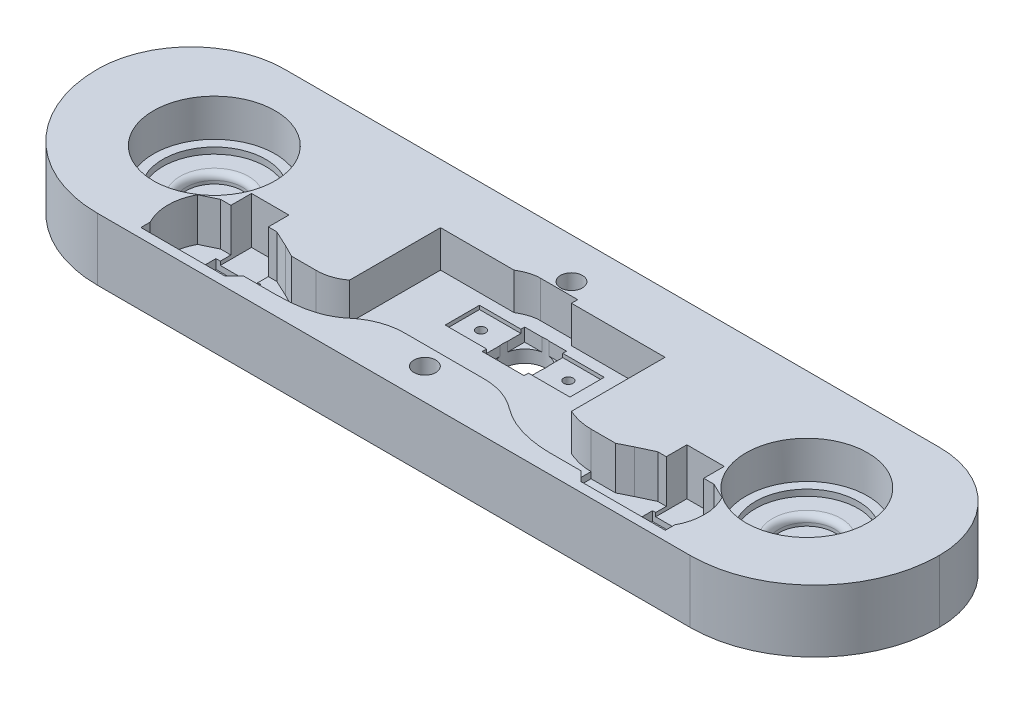
from build123d import *

# Parameters (mm, degrees)
SKETCH1_W                = 135
SKETCH1_H                = 35
BOSS_EXTRUDE1_DEPTH      = 10
FILLET1_R                = 20
CUT_EXTRUDE3_REACH       = 93.483
SKETCH5_R                = 1.75
SKETCH6_R                = 3.1
CUT_EXTRUDE4_DEPTH       = 4
FILLET2_R                = 15
SKETCH3_R                = 9.75
CUT_EXTRUDE5_DEPTH       = 7
BOSS_EXTRUDE2_START      = 1
SKETCH9_R                = 9.75
SKETCH9_R_2              = 8.25
BOSS_EXTRUDE2_DEPTH      = 1
SKETCH10_R               = 4.5
CUT_EXTRUDE6_DEPTH       = 1.5
FILLET3_R                = 1
CUT_EXTRUDE7_REACH       = 93.483
SKETCH7_R                = 2.5
SKETCH11_W               = 7.2
SKETCH11_H               = 6.2
CUT_EXTRUDE8_DEPTH       = 8.4
CUT_EXTRUDE9_DEPTH       = 6.9
CUT_EXTRUDE10_DEPTH      = 5.9
CUT_EXTRUDE11_REACH      = 93.483
SKETCH14_R               = 3.4
CUT_EXTRUDE12_DEPTH      = 5.9
CUT_EXTRUDE12_DEPTH_BACK = 2.1
SKETCH15_W               = 6.7
SKETCH15_H               = 6.8
SKETCH16_W               = 36
SKETCH16_H               = 17.5
CUT_EXTRUDE13_DEPTH      = 5.9
SKETCH18_W               = 6
SKETCH18_H               = 5
CUT_EXTRUDE14_DEPTH      = 7.5
SKETCH19_W               = 13
SKETCH19_H               = 1.5
CUT_EXTRUDE15_DEPTH      = 6.9
CHAMFER1_SIZE            = 2
CUT_EXTRUDE16_REACH      = 93.196
SKETCH20_R               = 0.7
SKETCH22_W               = 20
SKETCH22_H               = 5.5
CUT_EXTRUDE18_DEPTH      = 0.6
CUT_EXTRUDE19_REACH      = 93.166
SKETCH23_R               = 0.75
FILLET4_R                = 10


# Some blends are built 0.0001 mm under size
with BuildPart() as part:
    # Sketch1 → Boss-Extrude1 (new body)
    with BuildSketch(Plane(origin=(0, 0, 0), x_dir=(1, 0, 0), z_dir=(0, 1, 0))):
        with Locations((19.749798241, -8.123070146)):
            Rectangle(SKETCH1_W, SKETCH1_H)
    extrude(amount=BOSS_EXTRUDE1_DEPTH)

    # Fillet1
    fillet1_edges = [part.edges().sort_by_distance(p)[0] for p in [
        (87.249798241, 5, 25.623070146),
        (-47.750201759, 5, 25.623070146),
    ]]
    fillet(fillet1_edges, radius=FILLET1_R)

    # Sketch5 → Cut-Extrude3 (cut, up to next)
    with BuildSketch(Plane(origin=(0, 10, 0), x_dir=(1, 0, 0), z_dir=(0, 1, 0)), mode=Mode.PRIVATE) as cut_extrude3_sk1:
        with Locations(Location((19.749798241, 2.876929854, 0), (0, 0, 270))):
            Circle(SKETCH5_R)
    cut_extrude3_tool1 = extrude(cut_extrude3_sk1.sketch, amount=-CUT_EXTRUDE3_REACH, mode=Mode.PRIVATE) & part.part
    # Sketch5 → Cut-Extrude3 (cut, up to next)
    with BuildSketch(Plane(origin=(0, 10, 0), x_dir=(1, 0, 0), z_dir=(0, 1, 0)), mode=Mode.PRIVATE) as cut_extrude3_sk2:
        with Locations(Location((19.749798241, -20.623070146, 0), (0, 0, 270))):
            Circle(SKETCH5_R)
    cut_extrude3_tool2 = extrude(cut_extrude3_sk2.sketch, amount=-CUT_EXTRUDE3_REACH, mode=Mode.PRIVATE) & part.part
    add(cut_extrude3_tool1.solids().sort_by_distance((19.749798, 10, -2.87693))[0], mode=Mode.SUBTRACT)
    add(cut_extrude3_tool2.solids().sort_by_distance((19.749798, 10, 20.62307))[0], mode=Mode.SUBTRACT)

    # Sketch6 → Cut-Extrude4 (cut)
    with BuildSketch(Plane.XZ):
        with Locations(Location((19.749798241, 20.623070146, 0), (0, 0, 270))):
            Circle(SKETCH6_R)
        with Locations(Location((19.749798241, -2.876929854, 0), (0, 0, 270))):
            Circle(SKETCH6_R)
    extrude(amount=-CUT_EXTRUDE4_DEPTH, mode=Mode.SUBTRACT)

    # Fillet2
    fillet2_edges = [part.edges().sort_by_distance(p)[0] for p in [
        (-47.750201759, 5, -9.376929854),
        (87.249798241, 5, -9.376929854),
    ]]
    fillet(fillet2_edges, radius=FILLET2_R - 0.0001)  # a hair under: the kernel refuses the full size

    # Sketch3 → Cut-Extrude5 (cut)
    with BuildSketch(Plane(origin=(0, 10, 0), x_dir=(1, 0, 0), z_dir=(0, 1, 0))):
        with Locations(Location((-27.750201759, -6.88629089, 0), (0, 0, 270))):
            Circle(SKETCH3_R)
        with Locations(Location((67.249798241, -6.88629089, 0), (0, 0, 90))):
            Circle(SKETCH3_R)
    extrude(amount=-CUT_EXTRUDE5_DEPTH, mode=Mode.SUBTRACT)

    # Sketch9 → Boss-Extrude2 (add)
    # profile 1 of 2: a face of its own
    with BuildSketch(Plane(origin=(0, 3, 0), x_dir=(1, 0, 0), z_dir=(0, 1, 0)).offset(BOSS_EXTRUDE2_START)):
        with Locations(Location((-27.750201759, -6.88629089, 0), (0, 0, 270))):
            Circle(SKETCH9_R)
        with Locations(Location((-27.750201759, -6.88629089, 0), (0, 0, 270))):
            Circle(SKETCH9_R_2, mode=Mode.SUBTRACT)
    # profile 2 of 2: a face of its own
    with BuildSketch(Plane(origin=(0, 3, 0), x_dir=(1, 0, 0), z_dir=(0, 1, 0)).offset(BOSS_EXTRUDE2_START)):
        with Locations(Location((67.249798241, -6.88629089, 0), (0, 0, 270))):
            Circle(SKETCH9_R)
        with Locations(Location((67.249798241, -6.88629089, 0), (0, 0, 270))):
            Circle(SKETCH9_R_2, mode=Mode.SUBTRACT)
    extrude(amount=-BOSS_EXTRUDE2_DEPTH)

    # Sketch10 → Cut-Extrude6 (cut)
    with BuildSketch(Plane(origin=(0, 3, 0), x_dir=(1, 0, 0), z_dir=(0, 1, 0))):
        with Locations(Location((-27.750201759, -6.88629089, 0), (0, 0, 270))):
            Circle(SKETCH10_R)
        with Locations(Location((67.249798241, -6.88629089, 0), (0, 0, 270))):
            Circle(SKETCH10_R)
    extrude(amount=-CUT_EXTRUDE6_DEPTH, mode=Mode.SUBTRACT)

    # Fillet3
    fillet3_edges = [part.edges().sort_by_distance(p)[0] for p in [
        (-27.750201759, 3, 2.38629089),
        (67.249798241, 3, 2.38629089),
    ]]
    fillet(fillet3_edges, radius=FILLET3_R)

    # Sketch7 → Cut-Extrude7 (cut, up to next)
    with BuildSketch(Plane(origin=(0, 10, 0), x_dir=(1, 0, 0), z_dir=(0, 1, 0)), mode=Mode.PRIVATE) as cut_extrude7_sk1:
        with Locations(Location((-15.250201759, -18.623070146, 0), (0, 0, 270))):
            Circle(SKETCH7_R)
    cut_extrude7_tool1 = extrude(cut_extrude7_sk1.sketch, amount=-CUT_EXTRUDE7_REACH, mode=Mode.PRIVATE) & part.part
    # Sketch7 → Cut-Extrude7 (cut, up to next)
    with BuildSketch(Plane(origin=(0, 10, 0), x_dir=(1, 0, 0), z_dir=(0, 1, 0)), mode=Mode.PRIVATE) as cut_extrude7_sk2:
        with Locations(Location((54.749798241, -18.623070146, 0), (0, 0, 270))):
            Circle(SKETCH7_R)
    cut_extrude7_tool2 = extrude(cut_extrude7_sk2.sketch, amount=-CUT_EXTRUDE7_REACH, mode=Mode.PRIVATE) & part.part
    add(cut_extrude7_tool1.solids().sort_by_distance((-15.250202, 10, 18.62307))[0], mode=Mode.SUBTRACT)
    add(cut_extrude7_tool2.solids().sort_by_distance((54.749798, 10, 18.62307))[0], mode=Mode.SUBTRACT)

    # Sketch11 → Cut-Extrude8 (cut)
    with BuildSketch(Plane(origin=(0, 10, 0), x_dir=(1, 0, 0), z_dir=(0, 1, 0))):
        with Locations((-15.250201759, -18.623070146)):
            Rectangle(SKETCH11_W, SKETCH11_H)
        with Locations((54.749798241, -18.623070146)):
            Rectangle(SKETCH11_W, SKETCH11_H)
    extrude(amount=-CUT_EXTRUDE8_DEPTH, mode=Mode.SUBTRACT)

    # Sketch12 → Cut-Extrude9 (cut)
    with BuildSketch(Plane(origin=(0, 10, 0), x_dir=(1, 0, 0), z_dir=(0, 1, 0))):
        with BuildLine():
            Line((-2.290088122, -16.023070146), (-2.290088122, -22.623070146))
            Line((-2.290088122, -22.623070146), (-22.290088122, -22.623070146))
            ThreePointArc((-22.290088122, -22.623070146), (-23.250201759, -18.823070146), (-22.290088122, -15.023070146))
            Line((-22.290088122, -15.023070146), (-8.226250735, -15.023070146))
            Line((-8.226250735, -15.023070146), (-6.226250735, -16.023070146))
            Line((-6.226250735, -16.023070146), (-2.290088122, -16.023070146))
        make_face()
        with BuildLine():
            Line((45.725847218, -16.023070146), (41.789684604, -16.023070146))
            Line((41.789684604, -16.023070146), (41.789684604, -22.623070146))
            Line((41.789684604, -22.623070146), (61.789684604, -22.623070146))
            ThreePointArc((61.789684604, -22.623070146), (62.749798241, -18.823070146), (61.789684604, -15.023070146))
            Line((61.789684604, -15.023070146), (47.725847218, -15.023070146))
            Line((47.725847218, -15.023070146), (45.725847218, -16.023070146))
        make_face()
    extrude(amount=-CUT_EXTRUDE9_DEPTH, mode=Mode.SUBTRACT)

    # Sketch13 → Cut-Extrude10 (cut)
    with BuildSketch(Plane(origin=(0, 10, 0), x_dir=(1, 0, 0), z_dir=(0, 1, 0))):
        with BuildLine():
            Line((16.749798241, -6.123070146), (16.749798241, -10.123070146))
            Line((16.749798241, -10.123070146), (22.749798241, -10.123070146))
            add(Edge.make_bspline(
                [(22.749798241, -10.123070146), (24.722036045, -10.123070146), (28.163979579, -15.633237451), (33.12171253, -21.326637483), (39.095893997, -22.623070146), (41.789684604, -22.623070146)],
                knots=[0, 0, 0, 0, 0.267210119, 0.665147789, 1, 1, 1, 1], degree=3))
            Line((41.789684604, -22.623070146), (41.789684604, -16.023070146))
            add(Edge.make_bspline(
                [(22.749798241, -3.123070146), (25.404352013, -3.123070146), (30.639958492, -6.486500824), (33.826455572, -13.659608817), (39.207647597, -16.023070146), (41.789684604, -16.023070146)],
                knots=[0, 0, 0, 0, 0.352458843, 0.667620914, 1, 1, 1, 1], degree=3))
            Line((22.749798241, -3.123070146), (22.749798241, 0.876929854))
            Line((22.749798241, 0.876929854), (16.749798241, 0.876929854))
            add(Edge.make_bspline(
                [(-2.290088122, -16.023070146), (1.030690921, -16.023070146), (5.021034942, -11.553320405), (8.441730898, -4.082439458), (13.994609535, 0.876929854), (16.749798241, 0.876929854)],
                knots=[0, 0, 0, 0, 0.303660765, 0.653033126, 1, 1, 1, 1], degree=3))
            Line((-2.290088122, -16.023070146), (-2.290088122, -22.623070146))
            add(Edge.make_bspline(
                [(-2.290088122, -22.623070146), (1.458082619, -22.623070146), (7.085257022, -21.467137706), (11.349322106, -13.849067405), (14.359844143, -6.123070146), (16.749798241, -6.123070146)],
                knots=[0, 0, 0, 0, 0.342742586, 0.656631576, 1, 1, 1, 1], degree=3))
        make_face()
    extrude(amount=-CUT_EXTRUDE10_DEPTH, mode=Mode.SUBTRACT)

    # Sketch14 → Cut-Extrude11 (cut, up to next)
    with BuildSketch(Plane.XZ, mode=Mode.PRIVATE) as cut_extrude11_sk1:
        with Locations(Location((19.749798241, 4.623070146, 0), (0, 0, 270))):
            Circle(SKETCH14_R)
    cut_extrude11_tool1 = extrude(cut_extrude11_sk1.sketch, amount=-CUT_EXTRUDE11_REACH, mode=Mode.PRIVATE) & part.part
    add(cut_extrude11_tool1.solids().sort_by_distance((19.749798, 0, 4.62307))[0], mode=Mode.SUBTRACT)

    # Sketch15 → Cut-Extrude12 (cut, two sides: drawn at the far end of the back side and taken through both)
    with BuildSketch(Plane(origin=(0, 4.1, 0), x_dir=(1, 0, 0), z_dir=(0, 1, 0)).offset(-CUT_EXTRUDE12_DEPTH_BACK)):
        with Locations((19.749798241, -4.673070146)):
            Rectangle(SKETCH15_W, SKETCH15_H)
    extrude(amount=CUT_EXTRUDE12_DEPTH + CUT_EXTRUDE12_DEPTH_BACK, mode=Mode.SUBTRACT)

    # Sketch16 → Cut-Extrude13 (cut)
    with BuildSketch(Plane(origin=(0, 10, 0), x_dir=(1, 0, 0), z_dir=(0, 1, 0))):
        with Locations((19.749798241, -8.873070146)):
            Rectangle(SKETCH16_W, SKETCH16_H)
    extrude(amount=-CUT_EXTRUDE13_DEPTH, mode=Mode.SUBTRACT)

    # Sketch18 → Cut-Extrude14 (cut)
    with BuildSketch(Plane(origin=(0, 10, 0), x_dir=(1, 0, 0), z_dir=(0, 1, 0))):
        with Locations((-15.150201759, -13.023070146)):
            Rectangle(SKETCH18_W, SKETCH18_H)
        with Locations((54.649798241, -13.023070146)):
            Rectangle(SKETCH18_W, SKETCH18_H)
    extrude(amount=-CUT_EXTRUDE14_DEPTH, mode=Mode.SUBTRACT)

    # Sketch19 → Cut-Extrude15 (cut)
    with BuildSketch(Plane(origin=(0, 10, 0), x_dir=(1, 0, 0), z_dir=(0, 1, 0))):
        with Locations((-15.790088122, -23.373070146)):
            Rectangle(SKETCH19_W, SKETCH19_H)
        with Locations((55.289684604, -23.373070146)):
            Rectangle(SKETCH19_W, SKETCH19_H)
        Polygon((-22.290088122, -15.023070146), (-19.790088122, -13.823070146), (-10.790088122, -13.823070146), (-8.226250735, -15.023070146), align=None)
        Polygon((47.725847218, -15.023070146), (61.789684604, -15.023070146), (59.289684604, -13.823070146), (50.289684604, -13.823070146), align=None)
    extrude(amount=-CUT_EXTRUDE15_DEPTH, mode=Mode.SUBTRACT)

    # Chamfer1
    # the kernel refuses this chamfer: 2 mm, written as the material it takes off along each edge
    with BuildSketch(Plane(origin=(48.789684604, 15.143365976, 22.623070146), x_dir=(-0.9996219169112968, 0, -0.027495876610585647), z_dir=(0, -1, 0))) as chamfer1_piece_1_section:
        Polygon((CHAMFER1_SIZE * 0.999621916911, -CHAMFER1_SIZE * 0.0274958766106), (-CHAMFER1_SIZE * 0.0274958766106, -CHAMFER1_SIZE * 0.999621916911), (0, 0), align=None)
    chamfer1_piece_1 = extrude(amount=12.043365976, mode=Mode.PRIVATE)
    chamfer1_piece_1 = split(chamfer1_piece_1, bisect_by=Plane(origin=(48.085766383, 9.121682988, 24.123070146), z_dir=(0, 0, -1)), keep=Keep.TOP, mode=Mode.PRIVATE)
    add(chamfer1_piece_1, mode=Mode.SUBTRACT)
    with BuildSketch(Plane(origin=(-9.290088122, 15.143365976, 22.623070146), x_dir=(-0.02749587661058651, 0, 0.9996219169112968), z_dir=(0, -1, 0))) as chamfer1_piece_2_section:
        Polygon((CHAMFER1_SIZE * 0.999621916911, -CHAMFER1_SIZE * 0.0274958766106), (-CHAMFER1_SIZE * 0.0274958766106, -CHAMFER1_SIZE * 0.999621916911), (0, 0), align=None)
    chamfer1_piece_2 = extrude(amount=12.043365976, mode=Mode.PRIVATE)
    chamfer1_piece_2 = split(chamfer1_piece_2, bisect_by=Plane(origin=(-8.586169901, 9.121682988, 24.123070146), z_dir=(0, 0, -1)), keep=Keep.TOP, mode=Mode.PRIVATE)
    add(chamfer1_piece_2, mode=Mode.SUBTRACT)

    # Sketch20 → Cut-Extrude16 (cut, up to next)
    with BuildSketch(Plane(origin=(0, 3.1, 0), x_dir=(1, 0, 0), z_dir=(0, 1, 0)), mode=Mode.PRIVATE) as cut_extrude16_sk1:
        with Locations(Location((-20.750201759, -18.623070146, 0), (0, 0, 270))):
            Circle(SKETCH20_R)
    cut_extrude16_tool1 = extrude(cut_extrude16_sk1.sketch, amount=-CUT_EXTRUDE16_REACH, mode=Mode.PRIVATE) & part.part
    # Sketch20 → Cut-Extrude16 (cut, up to next)
    with BuildSketch(Plane(origin=(0, 3.1, 0), x_dir=(1, 0, 0), z_dir=(0, 1, 0)), mode=Mode.PRIVATE) as cut_extrude16_sk2:
        with Locations(Location((-9.750201759, -18.623070146, 0), (0, 0, 270))):
            Circle(SKETCH20_R)
    cut_extrude16_tool2 = extrude(cut_extrude16_sk2.sketch, amount=-CUT_EXTRUDE16_REACH, mode=Mode.PRIVATE) & part.part
    # Sketch20 → Cut-Extrude16 (cut, up to next)
    with BuildSketch(Plane(origin=(0, 3.1, 0), x_dir=(1, 0, 0), z_dir=(0, 1, 0)), mode=Mode.PRIVATE) as cut_extrude16_sk3:
        with Locations(Location((49.249798241, -18.623070146, 0), (0, 0, 270))):
            Circle(SKETCH20_R)
    cut_extrude16_tool3 = extrude(cut_extrude16_sk3.sketch, amount=-CUT_EXTRUDE16_REACH, mode=Mode.PRIVATE) & part.part
    # Sketch20 → Cut-Extrude16 (cut, up to next)
    with BuildSketch(Plane(origin=(0, 3.1, 0), x_dir=(1, 0, 0), z_dir=(0, 1, 0)), mode=Mode.PRIVATE) as cut_extrude16_sk4:
        with Locations(Location((60.249798241, -18.623070146, 0), (0, 0, 270))):
            Circle(SKETCH20_R)
    cut_extrude16_tool4 = extrude(cut_extrude16_sk4.sketch, amount=-CUT_EXTRUDE16_REACH, mode=Mode.PRIVATE) & part.part
    add(cut_extrude16_tool1.solids().sort_by_distance((-20.750202, 3.1, 18.62307))[0], mode=Mode.SUBTRACT)
    add(cut_extrude16_tool2.solids().sort_by_distance((-9.750202, 3.1, 18.62307))[0], mode=Mode.SUBTRACT)
    add(cut_extrude16_tool3.solids().sort_by_distance((49.249798, 3.1, 18.62307))[0], mode=Mode.SUBTRACT)
    add(cut_extrude16_tool4.solids().sort_by_distance((60.249798, 3.1, 18.62307))[0], mode=Mode.SUBTRACT)

    # Sketch22 → Cut-Extrude18 (cut)
    with BuildSketch(Plane(origin=(0, 4.1, 0), x_dir=(1, 0, 0), z_dir=(0, 1, 0))):
        with Locations((19.749798241, -4.623070146)):
            Rectangle(SKETCH22_W, SKETCH22_H)
    extrude(amount=-CUT_EXTRUDE18_DEPTH, mode=Mode.SUBTRACT)

    # Sketch23 → Cut-Extrude19 (cut, up to next)
    with BuildSketch(Plane(origin=(0, 3.5, 0), x_dir=(1, 0, 0), z_dir=(0, 1, 0)), mode=Mode.PRIVATE) as cut_extrude19_sk1:
        with Locations(Location((12.749798241, -4.623070146, 0), (0, 0, 270))):
            Circle(SKETCH23_R)
    cut_extrude19_tool1 = extrude(cut_extrude19_sk1.sketch, amount=-CUT_EXTRUDE19_REACH, mode=Mode.PRIVATE) & part.part
    # Sketch23 → Cut-Extrude19 (cut, up to next)
    with BuildSketch(Plane(origin=(0, 3.5, 0), x_dir=(1, 0, 0), z_dir=(0, 1, 0)), mode=Mode.PRIVATE) as cut_extrude19_sk2:
        with Locations(Location((26.749798241, -4.623070146, 0), (0, 0, 270))):
            Circle(SKETCH23_R)
    cut_extrude19_tool2 = extrude(cut_extrude19_sk2.sketch, amount=-CUT_EXTRUDE19_REACH, mode=Mode.PRIVATE) & part.part
    add(cut_extrude19_tool1.solids().sort_by_distance((12.749798, 3.5, 4.62307))[0], mode=Mode.SUBTRACT)
    add(cut_extrude19_tool2.solids().sort_by_distance((26.749798, 3.5, 4.62307))[0], mode=Mode.SUBTRACT)

    # Fillet4
    fillet4_edges = [part.edges().sort_by_distance(p)[0] for p in [
        (30.099886031, 7.05, 17.623070146),
        (9.04256164, 7.05, 17.623070146),
    ]]
    fillet(fillet4_edges, radius=FILLET4_R)


solid = part.part
